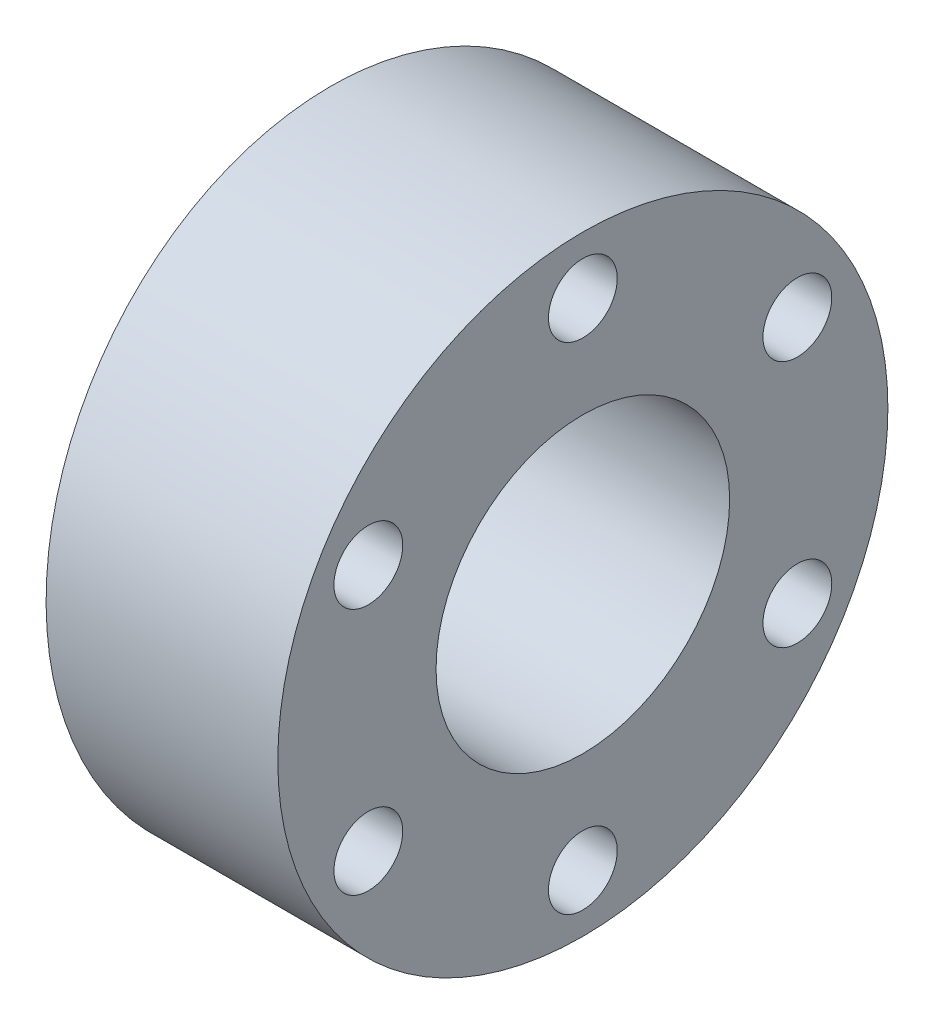
from build123d import *

# Parameters (mm, degrees)
SKETCH1_R               = 16.891
BOSS_EXTRUDE1_DEPTH     = 13.97
SKETCH2_R               = 8.128
CUT_EXTRUDE1_DEPTH      = 28.672597674
CUT_EXTRUDE2_DEPTH      = 28.672597674
CUT_EXTRUDE2_DEPTH_BACK = 28.672597674
SKETCH7_R               = 1.905
CUT_EXTRUDE3_DEPTH      = 28.672597674
CIRPATTERN1_COUNT       = 6


with BuildPart() as part:
    # Sketch1 → Boss-Extrude1 (new body)
    with BuildSketch(Plane(origin=(0, 0, 0), x_dir=(0, 0, -1), z_dir=(1, 0, 0))):
        Circle(SKETCH1_R)
    extrude(amount=BOSS_EXTRUDE1_DEPTH)

    # Sketch2 → Cut-Extrude1 (cut, through all)
    with BuildSketch(Plane(origin=(13.97, 0, 0), x_dir=(0, 0, -1), z_dir=(1, 0, 0))):
        Circle(SKETCH2_R)
    extrude(amount=-CUT_EXTRUDE1_DEPTH, mode=Mode.SUBTRACT)

    # Sketch3 → Cut-Extrude2 (cut, two sides: drawn at the far end of the back side and taken through both)
    with BuildSketch(Plane.XY.offset(-CUT_EXTRUDE2_DEPTH_BACK)):
        Polygon((0, 16.891), (2.362267561, -16.891), (0, -16.891), align=None)
    extrude(amount=CUT_EXTRUDE2_DEPTH + CUT_EXTRUDE2_DEPTH_BACK, mode=Mode.SUBTRACT)

    # Sketch7 → Cut-Extrude3 (cut, through all)
    with BuildSketch(Plane(origin=(13.97, 0, 0), x_dir=(0, 0, -1), z_dir=(1, 0, 0))):
        with Locations((0, 13.716)):
            Circle(SKETCH7_R)
    cut_extrude3 = extrude(amount=-CUT_EXTRUDE3_DEPTH, mode=Mode.SUBTRACT)

    # CirPattern1: Cut-Extrude3 ×6 about axis
    cirpattern1_axis = Axis((0.612768653, 0, 0), (1, 0, 0))
    for i in range(1, CIRPATTERN1_COUNT):
        add(cut_extrude3.rotate(cirpattern1_axis, i * 360 / CIRPATTERN1_COUNT), mode=Mode.SUBTRACT)


solid = part.part
